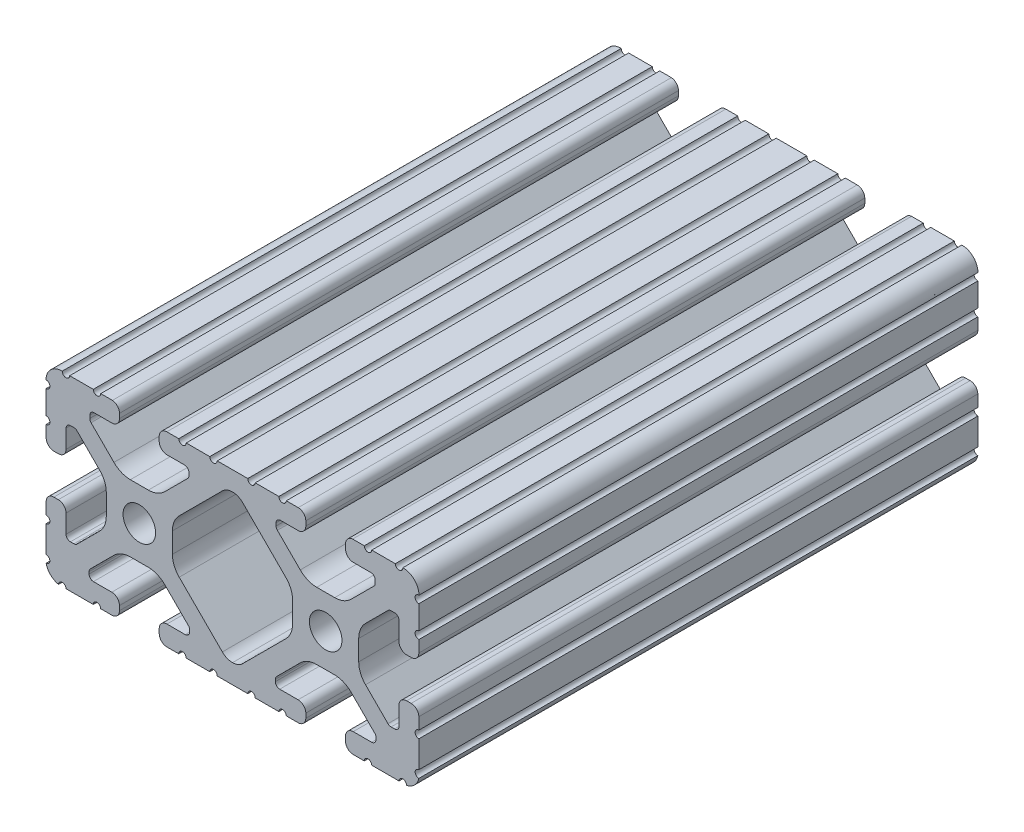
from build123d import *

# Parameters (mm, degrees)
SKETCH1_R      = 3.3274
EXTRUDE1_DEPTH = 114.3


with BuildPart() as part:
    # Sketch1 → Extrude1 (new body)
    with BuildSketch(Plane.XY):
        with BuildLine():
            Line((-3.121121376, -19.05), (3.121121376, -19.05))
            ThreePointArc((3.121121376, -19.05), (3.883121376, -18.288), (4.645121376, -19.05))
            Line((4.645121376, -19.05), (8.633115796, -19.05))
            Line((8.633115796, -19.05), (9.473536067, -19.05))
            ThreePointArc((9.473536067, -19.05), (10.235536067, -18.288), (10.997536067, -19.05))
            Line((10.997536067, -19.05), (13.4112, -19.05))
            ThreePointArc((13.4112, -19.05), (14.524751759, -18.588751759), (14.986, -17.4752))
            Line((14.986, -17.4752), (14.986, -16.5608))
            ThreePointArc((14.986, -16.5608), (14.524751759, -15.447248241), (13.4112, -14.986))
            Line((13.4112, -14.986), (9.652, -14.986))
            ThreePointArc((9.652, -14.986), (9.023382072, -14.725617928), (8.763, -14.097))
            Line((8.763, -14.097), (8.763, -13.687179678))
            ThreePointArc((8.763, -13.687179678), (8.830670671, -13.346975131), (9.023380503, -13.058563318))
            Line((9.023380503, -13.058563318), (13.852498595, -8.229421131))
            ThreePointArc((13.852498595, -8.229421131), (15.393447522, -7.199787805), (17.211122763, -6.838228541))
            Line((17.211122763, -6.838228541), (20.888877237, -6.838228541))
            ThreePointArc((20.888877237, -6.838228541), (22.706552478, -7.199787805), (24.247501405, -8.229421131))
            Line((24.247501405, -8.229421131), (29.076619497, -13.058563318))
            ThreePointArc((29.076619497, -13.058563318), (29.269329329, -13.346975131), (29.337, -13.687179678))
            Line((29.337, -13.687179678), (29.337, -14.097))
            ThreePointArc((29.337, -14.097), (29.076617928, -14.725617928), (28.448, -14.986))
            Line((28.448, -14.986), (24.6888, -14.986))
            ThreePointArc((24.6888, -14.986), (23.575248241, -15.447248241), (23.114, -16.5608))
            Line((23.114, -16.5608), (23.114, -17.4752))
            ThreePointArc((23.114, -17.4752), (23.575248241, -18.588751759), (24.6888, -19.05))
            Line((24.6888, -19.05), (26.945817469, -19.05))
            ThreePointArc((26.945817469, -19.05), (27.707817469, -18.288), (28.469817469, -19.05))
            Line((28.469817469, -19.05), (29.207115796, -19.05))
            Line((29.207115796, -19.05), (34.047273398, -19.05))
            ThreePointArc((34.047273398, -19.05), (34.809273398, -18.288), (35.571273398, -19.05))
            ThreePointArc((35.571273398, -19.05), (37.207577603, -18.182738167), (38.1, -16.560019212))
            ThreePointArc((38.1, -16.560019212), (37.338, -15.798019212), (38.1, -15.036019212))
            Line((38.1, -15.036019212), (38.1, -10.287))
            Line((38.1, -10.287), (38.1, -9.549701672))
            ThreePointArc((38.1, -9.549701672), (37.338, -8.787701672), (38.1, -8.025701672))
            Line((38.1, -8.025701672), (38.1, -5.6388))
            ThreePointArc((38.1, -5.6388), (37.638751759, -4.525248241), (36.5252, -4.064))
            Line((36.5252, -4.064), (35.6108, -4.064))
            ThreePointArc((35.6108, -4.064), (34.497248241, -4.525248241), (34.036, -5.6388))
            Line((34.036, -5.6388), (34.036, -9.398))
            ThreePointArc((34.036, -9.398), (33.775617928, -10.026617928), (33.147, -10.287))
            Line((33.147, -10.287), (32.420656743, -10.287))
            ThreePointArc((32.420656743, -10.287), (32.080450147, -10.21932848), (31.792037247, -10.02661636))
            Line((31.792037247, -10.02661636), (27.197575832, -5.43213202))
            ThreePointArc((27.197575832, -5.43213202), (26.167954729, -3.891188903), (25.8064, -2.07352461))
            Line((25.8064, -2.07352461), (25.8064, 2.07352461))
            ThreePointArc((25.8064, 2.07352461), (26.167954729, 3.891188903), (27.197575832, 5.43213202))
            Line((27.197575832, 5.43213202), (31.792037247, 10.02661636))
            ThreePointArc((31.792037247, 10.02661636), (32.080450147, 10.21932848), (32.420656743, 10.287))
            Line((32.420656743, 10.287), (33.147, 10.287))
            ThreePointArc((33.147, 10.287), (33.775617928, 10.026617928), (34.036, 9.398))
            Line((34.036, 9.398), (34.036, 5.6388))
            ThreePointArc((34.036, 5.6388), (34.497248241, 4.525248241), (35.6108, 4.064))
            Line((35.6108, 4.064), (36.5252, 4.064))
            ThreePointArc((36.5252, 4.064), (37.638751759, 4.525248241), (38.1, 5.6388))
            Line((38.1, 5.6388), (38.1, 8.025701672))
            ThreePointArc((38.1, 8.025701672), (37.338, 8.787701672), (38.1, 9.549701672))
            Line((38.1, 9.549701672), (38.1, 10.287))
            Line((38.1, 10.287), (38.1, 14.375206214))
            ThreePointArc((38.1, 14.375206214), (37.338232276, 15.156019383), (38.137614868, 15.89827725))
            ThreePointArc((38.137614868, 15.89827725), (37.148019028, 18.192014021), (34.819536496, 19.096833012))
            ThreePointArc((34.819536496, 19.096833012), (34.081312886, 18.311776389), (33.296256263, 19.05))
            Line((33.296256263, 19.05), (29.207115796, 19.05))
            Line((29.207115796, 19.05), (28.469817468, 19.05))
            ThreePointArc((28.469817468, 19.05), (27.707817468, 18.288), (26.945817468, 19.05))
            Line((26.945817468, 19.05), (24.558915796, 19.05))
            ThreePointArc((24.558915796, 19.05), (23.53023695, 18.547208069), (23.114, 17.480565346))
            Line((23.114, 17.480565346), (23.114, 16.5608))
            ThreePointArc((23.114, 16.5608), (23.575248241, 15.447248241), (24.6888, 14.986))
            Line((24.6888, 14.986), (28.295243665, 14.986))
            ThreePointArc((28.295243665, 14.986), (28.923861593, 14.725617928), (29.184243665, 14.097))
            Line((29.184243665, 14.097), (29.184243665, 13.53442258))
            ThreePointArc((29.184243665, 13.53442258), (29.116572993, 13.194218033), (28.923863161, 12.90580622))
            Line((28.923863161, 12.90580622), (24.247501405, 8.229421131))
            ThreePointArc((24.247501405, 8.229421131), (22.706552478, 7.199787805), (20.888877237, 6.838228541))
            Line((20.888877237, 6.838228541), (17.211122763, 6.838228541))
            ThreePointArc((17.211122763, 6.838228541), (15.393447522, 7.199787805), (13.852498595, 8.229421131))
            Line((13.852498595, 8.229421131), (9.176136839, 12.90580622))
            ThreePointArc((9.176136839, 12.90580622), (8.983427007, 13.194218033), (8.915756335, 13.53442258))
            Line((8.915756335, 13.53442258), (8.915756335, 14.097))
            ThreePointArc((8.915756335, 14.097), (9.176138407, 14.725617928), (9.804756335, 14.986))
            Line((9.804756335, 14.986), (13.4112, 14.986))
            ThreePointArc((13.4112, 14.986), (14.524751759, 15.447248241), (14.986, 16.5608))
            Line((14.986, 16.5608), (14.986, 17.496772581))
            ThreePointArc((14.986, 17.496772581), (14.531070222, 18.595070222), (13.432772581, 19.05))
            Line((13.432772581, 19.05), (10.997536067, 19.05))
            ThreePointArc((10.997536067, 19.05), (10.235536067, 18.288), (9.473536067, 19.05))
            Line((9.473536067, 19.05), (8.633115796, 19.05))
            Line((8.633115796, 19.05), (4.645121376, 19.05))
            ThreePointArc((4.645121376, 19.05), (3.883121376, 18.288), (3.121121376, 19.05))
            Line((3.121121376, 19.05), (-3.121121376, 19.05))
            ThreePointArc((-3.121121376, 19.05), (-3.883121376, 18.288), (-4.645121376, 19.05))
            Line((-4.645121376, 19.05), (-8.633115796, 19.05))
            Line((-8.633115796, 19.05), (-9.473536067, 19.05))
            ThreePointArc((-9.473536067, 19.05), (-10.235536067, 18.288), (-10.997536067, 19.05))
            Line((-10.997536067, 19.05), (-13.432772581, 19.05))
            ThreePointArc((-13.432772581, 19.05), (-14.531070222, 18.595070222), (-14.986, 17.496772581))
            Line((-14.986, 17.496772581), (-14.986, 16.5608))
            ThreePointArc((-14.986, 16.5608), (-14.524751759, 15.447248241), (-13.4112, 14.986))
            Line((-13.4112, 14.986), (-9.804756335, 14.986))
            ThreePointArc((-9.804756335, 14.986), (-9.176138407, 14.725617928), (-8.915756335, 14.097))
            Line((-8.915756335, 14.097), (-8.915756335, 13.53442258))
            ThreePointArc((-8.915756335, 13.53442258), (-8.983427007, 13.194218033), (-9.176136839, 12.90580622))
            Line((-9.176136839, 12.90580622), (-13.852498595, 8.229421131))
            ThreePointArc((-13.852498595, 8.229421131), (-15.393447522, 7.199787805), (-17.211122763, 6.838228541))
            Line((-17.211122763, 6.838228541), (-20.888877237, 6.838228541))
            ThreePointArc((-20.888877237, 6.838228541), (-22.706552478, 7.199787805), (-24.247501405, 8.229421131))
            Line((-24.247501405, 8.229421131), (-28.923863161, 12.90580622))
            ThreePointArc((-28.923863161, 12.90580622), (-29.116572993, 13.194218033), (-29.184243665, 13.53442258))
            Line((-29.184243665, 13.53442258), (-29.184243665, 14.097))
            ThreePointArc((-29.184243665, 14.097), (-28.923861593, 14.725617928), (-28.295243665, 14.986))
            Line((-28.295243665, 14.986), (-24.6888, 14.986))
            ThreePointArc((-24.6888, 14.986), (-23.575248241, 15.447248241), (-23.114, 16.5608))
            Line((-23.114, 16.5608), (-23.114, 17.480565346))
            ThreePointArc((-23.114, 17.480565346), (-23.53023695, 18.547208069), (-24.558915796, 19.05))
            Line((-24.558915796, 19.05), (-26.945817468, 19.05))
            ThreePointArc((-26.945817468, 19.05), (-27.707817468, 18.288), (-28.469817468, 19.05))
            Line((-28.469817468, 19.05), (-29.207115796, 19.05))
            Line((-29.207115796, 19.05), (-33.296256263, 19.05))
            ThreePointArc((-33.296256263, 19.05), (-34.081312886, 18.311776389), (-34.819536496, 19.096833012))
            ThreePointArc((-34.819536496, 19.096833012), (-37.148019028, 18.192014021), (-38.137614868, 15.89827725))
            ThreePointArc((-38.137614868, 15.89827725), (-37.338232276, 15.156019383), (-38.1, 14.375206214))
            Line((-38.1, 14.375206214), (-38.1, 10.287))
            Line((-38.1, 10.287), (-38.1, 9.549701672))
            ThreePointArc((-38.1, 9.549701672), (-37.338, 8.787701672), (-38.1, 8.025701672))
            Line((-38.1, 8.025701672), (-38.1, 5.6388))
            ThreePointArc((-38.1, 5.6388), (-37.638751759, 4.525248241), (-36.5252, 4.064))
            Line((-36.5252, 4.064), (-35.6108, 4.064))
            ThreePointArc((-35.6108, 4.064), (-34.497248241, 4.525248241), (-34.036, 5.6388))
            Line((-34.036, 5.6388), (-34.036, 9.398))
            ThreePointArc((-34.036, 9.398), (-33.775617928, 10.026617928), (-33.147, 10.287))
            Line((-33.147, 10.287), (-32.420656743, 10.287))
            ThreePointArc((-32.420656743, 10.287), (-32.080450147, 10.21932848), (-31.792037247, 10.02661636))
            Line((-31.792037247, 10.02661636), (-27.197575832, 5.43213202))
            ThreePointArc((-27.197575832, 5.43213202), (-26.167954729, 3.891188903), (-25.8064, 2.07352461))
            Line((-25.8064, 2.07352461), (-25.8064, -2.07352461))
            ThreePointArc((-25.8064, -2.07352461), (-26.167954729, -3.891188903), (-27.197575832, -5.43213202))
            Line((-27.197575832, -5.43213202), (-31.792037247, -10.02661636))
            ThreePointArc((-31.792037247, -10.02661636), (-32.080450147, -10.21932848), (-32.420656743, -10.287))
            Line((-32.420656743, -10.287), (-33.147, -10.287))
            ThreePointArc((-33.147, -10.287), (-33.775617928, -10.026617928), (-34.036, -9.398))
            Line((-34.036, -9.398), (-34.036, -5.6388))
            ThreePointArc((-34.036, -5.6388), (-34.497248241, -4.525248241), (-35.6108, -4.064))
            Line((-35.6108, -4.064), (-36.5252, -4.064))
            ThreePointArc((-36.5252, -4.064), (-37.638751759, -4.525248241), (-38.1, -5.6388))
            Line((-38.1, -5.6388), (-38.1, -8.025701672))
            ThreePointArc((-38.1, -8.025701672), (-37.338, -8.787701672), (-38.1, -9.549701672))
            Line((-38.1, -9.549701672), (-38.1, -10.287))
            Line((-38.1, -10.287), (-38.1, -15.036019212))
            ThreePointArc((-38.1, -15.036019212), (-37.338, -15.798019212), (-38.1, -16.560019212))
            ThreePointArc((-38.1, -16.560019212), (-37.20882252, -18.184002456), (-35.571273398, -19.05))
            ThreePointArc((-35.571273398, -19.05), (-34.809273398, -18.288), (-34.047273398, -19.05))
            Line((-34.047273398, -19.05), (-29.207115796, -19.05))
            Line((-29.207115796, -19.05), (-28.469817469, -19.05))
            ThreePointArc((-28.469817469, -19.05), (-27.707817469, -18.288), (-26.945817469, -19.05))
            Line((-26.945817469, -19.05), (-24.6888, -19.05))
            ThreePointArc((-24.6888, -19.05), (-23.575248241, -18.588751759), (-23.114, -17.4752))
            Line((-23.114, -17.4752), (-23.114, -16.5608))
            ThreePointArc((-23.114, -16.5608), (-23.575248241, -15.447248241), (-24.6888, -14.986))
            Line((-24.6888, -14.986), (-28.448, -14.986))
            ThreePointArc((-28.448, -14.986), (-29.076617928, -14.725617928), (-29.337, -14.097))
            Line((-29.337, -14.097), (-29.337, -13.687179678))
            ThreePointArc((-29.337, -13.687179678), (-29.269329329, -13.346975131), (-29.076619497, -13.058563318))
            Line((-29.076619497, -13.058563318), (-24.247501405, -8.229421131))
            ThreePointArc((-24.247501405, -8.229421131), (-22.706552478, -7.199787805), (-20.888877237, -6.838228541))
            Line((-20.888877237, -6.838228541), (-17.211122763, -6.838228541))
            ThreePointArc((-17.211122763, -6.838228541), (-15.393447522, -7.199787805), (-13.852498595, -8.229421131))
            Line((-13.852498595, -8.229421131), (-9.023380503, -13.058563318))
            ThreePointArc((-9.023380503, -13.058563318), (-8.830670671, -13.346975131), (-8.763, -13.687179678))
            Line((-8.763, -13.687179678), (-8.763, -14.097))
            ThreePointArc((-8.763, -14.097), (-9.023382072, -14.725617928), (-9.652, -14.986))
            Line((-9.652, -14.986), (-13.4112, -14.986))
            ThreePointArc((-13.4112, -14.986), (-14.524751759, -15.447248241), (-14.986, -16.5608))
            Line((-14.986, -16.5608), (-14.986, -17.4752))
            ThreePointArc((-14.986, -17.4752), (-14.524751759, -18.588751759), (-13.4112, -19.05))
            Line((-13.4112, -19.05), (-10.997536067, -19.05))
            ThreePointArc((-10.997536067, -19.05), (-10.235536067, -18.288), (-9.473536067, -19.05))
            Line((-9.473536067, -19.05), (-8.633115796, -19.05))
            Line((-8.633115796, -19.05), (-4.645121376, -19.05))
            ThreePointArc((-4.645121376, -19.05), (-3.883121376, -18.288), (-3.121121376, -19.05))
        make_face()
        with Locations((19.05, 0)):
            Circle(SKETCH1_R, mode=Mode.SUBTRACT)
        with Locations((-19.05, 0)):
            Circle(SKETCH1_R, mode=Mode.SUBTRACT)
        with BuildLine():
            Line((2.077035361, 14.257564863), (10.902424168, 5.43213202))
            ThreePointArc((10.902424168, 5.43213202), (11.932045271, 3.891188903), (12.2936, 2.07352461))
            Line((12.2936, 2.07352461), (12.2936, -2.07352461))
            ThreePointArc((12.2936, -2.07352461), (11.932045271, -3.891188903), (10.902424168, -5.43213202))
            Line((10.902424168, -5.43213202), (2.077035361, -14.257564863))
            ThreePointArc((2.077035361, -14.257564863), (1.124045601, -14.892973012), (0, -15.113096807))
            ThreePointArc((0, -15.113096807), (-1.124045601, -14.892973012), (-2.077035361, -14.257564863))
            Line((-2.077035361, -14.257564863), (-10.902424168, -5.43213202))
            ThreePointArc((-10.902424168, -5.43213202), (-11.932045271, -3.891188903), (-12.2936, -2.07352461))
            Line((-12.2936, -2.07352461), (-12.2936, 2.07352461))
            ThreePointArc((-12.2936, 2.07352461), (-11.932045271, 3.891188903), (-10.902424168, 5.43213202))
            Line((-10.902424168, 5.43213202), (-2.077035361, 14.257564863))
            ThreePointArc((-2.077035361, 14.257564863), (-1.124045601, 14.892973012), (0, 15.113096807))
            ThreePointArc((0, 15.113096807), (1.124045601, 14.892973012), (2.077035361, 14.257564863))
        make_face(mode=Mode.SUBTRACT)
    extrude(amount=-EXTRUDE1_DEPTH)


solid = part.part
